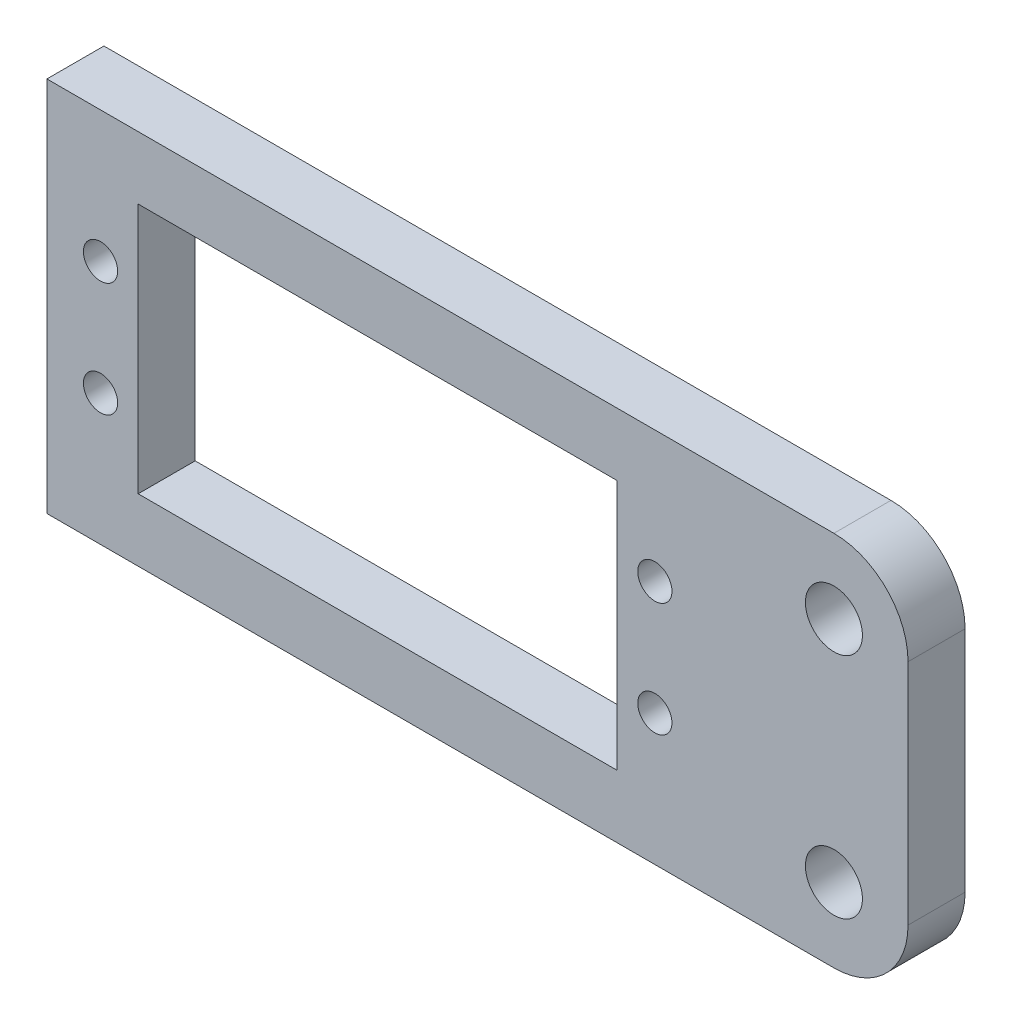
from build123d import *

# Parameters (mm, degrees)
SKETCH1_R           = 2.5
SKETCH1_R_2         = 1.5
SKETCH1_W           = 42
SKETCH1_H           = 22
BOSS_EXTRUDE1_DEPTH = 5


with BuildPart() as part:
    # Sketch1 → Boss-Extrude1 (new body)
    with BuildSketch(Plane.XY):
        with BuildLine():
            Line((40, -16.5), (-29, -16.5))
            Line((-29, -16.5), (-29, 16.5))
            Line((-29, 16.5), (40, 16.5))
            ThreePointArc((40, 16.5), (44.596194078, 14.596194078), (46.5, 10))
            Line((46.5, 10), (46.5, -10))
            ThreePointArc((46.5, -10), (44.596194078, -14.596194078), (40, -16.5))
        make_face()
        with Locations((40, -10)):
            Circle(SKETCH1_R, mode=Mode.SUBTRACT)
        with Locations((40, 10)):
            Circle(SKETCH1_R, mode=Mode.SUBTRACT)
        with Locations((24.3, 5)):
            Circle(SKETCH1_R_2, mode=Mode.SUBTRACT)
        with Locations((24.3, -5)):
            Circle(SKETCH1_R_2, mode=Mode.SUBTRACT)
        with Locations((-24.3, -5)):
            Circle(SKETCH1_R_2, mode=Mode.SUBTRACT)
        with Locations((-24.3, 5)):
            Circle(SKETCH1_R_2, mode=Mode.SUBTRACT)
        Rectangle(SKETCH1_W, SKETCH1_H, mode=Mode.SUBTRACT)
    extrude(amount=-BOSS_EXTRUDE1_DEPTH)


solid = part.part
